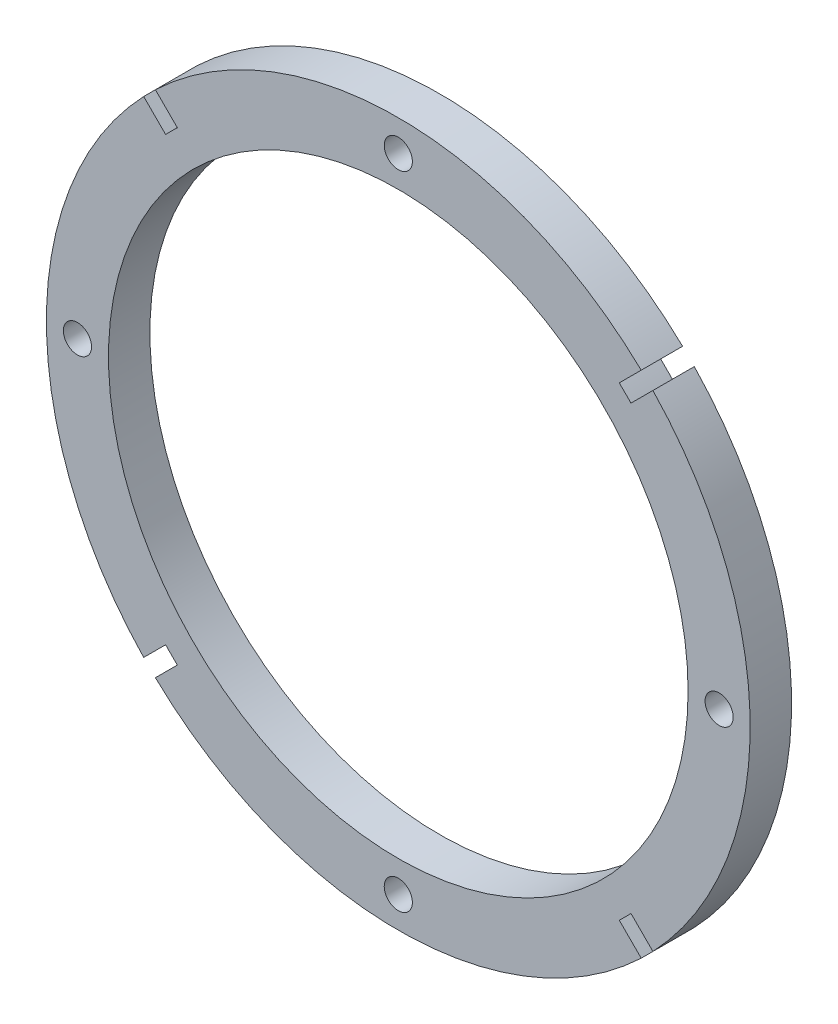
from build123d import *

# Parameters (mm, degrees)
SZKIC1_R                    = 85
SZKIC1_R_2                  = 70
DODANIE_WYCI_GNI_CIE1_DEPTH = 10
WYTNIJ_WYCI_GNI_CIE1_START  = -10
SZKIC2_R                    = 3.4
WYTNIJ_WYCI_GNI_CIE1_DEPTH  = 10
SZYK_KO_OWY1_COUNT          = 4


with BuildPart() as part:
    # Szkic1 → Dodanie-wyciągnięcie1 (new body)
    with BuildSketch(Plane.XY):
        Circle(SZKIC1_R)
        Circle(SZKIC1_R_2, mode=Mode.SUBTRACT)
    extrude(amount=DODANIE_WYCI_GNI_CIE1_DEPTH)

    # Szkic2 → Wytnij-wyciągnięcie1 (cut)
    with BuildSketch(Plane.XY.offset(10).offset(WYTNIJ_WYCI_GNI_CIE1_START)):
        with Locations((0, 77.5)):
            Circle(SZKIC2_R)
        with BuildLine():
            Line((-56.196738148, 53.368311023), (-61.501649853, 58.673222728))
            ThreePointArc((-61.501649853, 58.673222728), (-60.104076401, 60.104076401), (-58.673222728, 61.501649853))
            Line((-58.673222728, 61.501649853), (-53.368311023, 56.196738148))
            ThreePointArc((-53.368311023, 56.196738148), (-54.800775542, 54.800775542), (-56.196738148, 53.368311023))
        make_face()
    wytnij_wyci_gni_cie1 = extrude(amount=WYTNIJ_WYCI_GNI_CIE1_DEPTH, mode=Mode.SUBTRACT)

    # Szyk kołowy1: Wytnij-wyciągnięcie1 ×4 about axis
    szyk_ko_owy1_axis = Axis((0, 0, 10), (0, 0, -1))
    for i in range(1, SZYK_KO_OWY1_COUNT):
        add(wytnij_wyci_gni_cie1.rotate(szyk_ko_owy1_axis, i * 360 / SZYK_KO_OWY1_COUNT), mode=Mode.SUBTRACT)


solid = part.part
